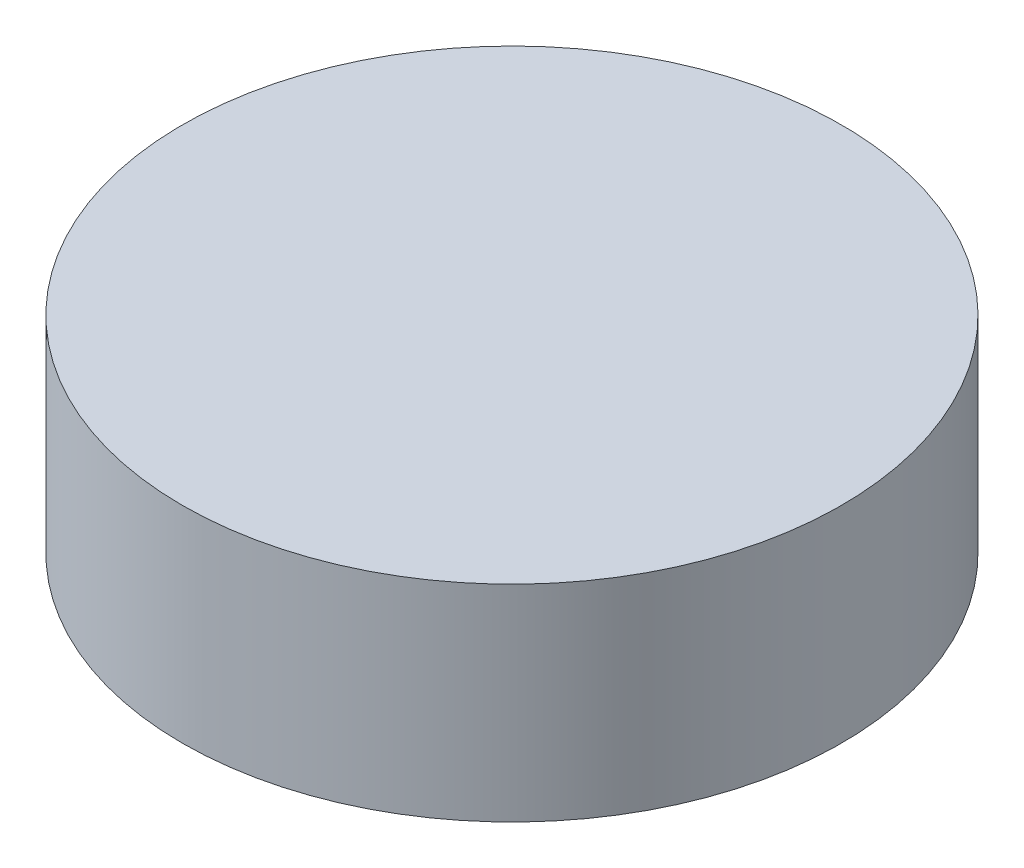
from build123d import *

# Parameters (mm, degrees)
SKETCH1_R           = 40
BOSS_EXTRUDE1_DEPTH = 25


with BuildPart() as part:
    # Sketch1 → Boss-Extrude1 (new body)
    with BuildSketch(Plane(origin=(0, 0, 0), x_dir=(1, 0, 0), z_dir=(0, 1, 0))):
        Circle(SKETCH1_R)
    extrude(amount=BOSS_EXTRUDE1_DEPTH)


solid = part.part
